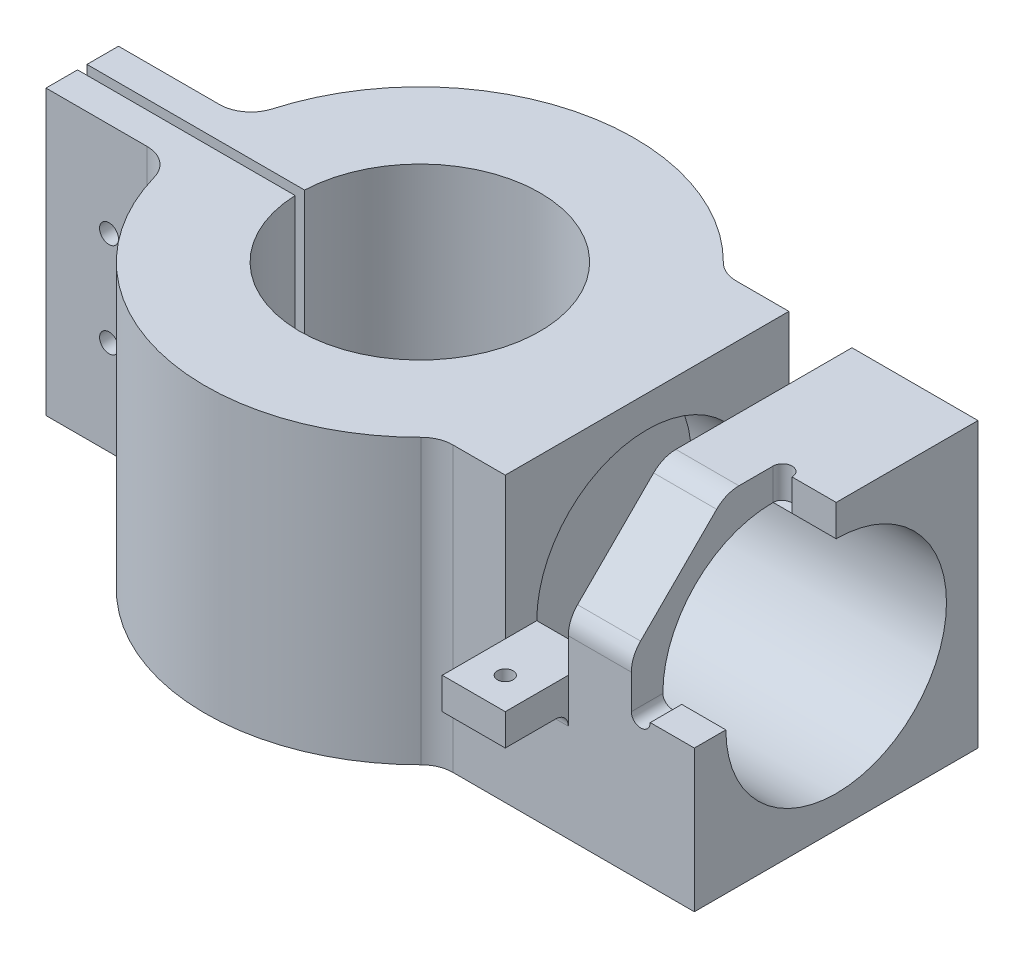
from build123d import *

# Parameters (mm, degrees)
BOSS_EXTRUDE1_DEPTH       = 22.5
F_3_0MM_DOWEL_HOLE1_D     = 3
BOSS_EXTRUDE2_START       = -8.493151603
BOSS_EXTRUDE2_OUTLINE_W   = 45
BOSS_EXTRUDE2_OUTLINE_H   = 45
BOSS_EXTRUDE2_DEPTH       = 40.493151603
SKETCH5_R                 = 17.5
CUT_EXTRUDE1_DEPTH        = 40.493152
SKETCH7_W                 = 10
SKETCH7_H                 = 45
CUT_EXTRUDE2_DEPTH        = 78.641837948
SKETCH8_W                 = 22.5
SKETCH8_H                 = 22.5
CUT_EXTRUDE3_DEPTH        = 10
CUT_EXTRUDE5_OUTLINE_W    = 1.5
CUT_EXTRUDE5_OUTLINE_H    = 5.064430618
CUT_EXTRUDE8_START        = 17.435595673
CUT_EXTRUDE8_DEPTH        = 5.064404327
SKETCH14_W                = 10
SKETCH14_H                = 15
BOSS_EXTRUDE3_DEPTH       = 5
M3X0_5_TAPPED_HOLE1_D     = 2.5
M3X0_5_TAPPED_HOLE1_DEPTH = 7.748924226
M3X0_5_TAPPED_HOLE1_TIP   = 0.751075774
CHAMFER1_SIZE             = 15
FILLET1_R                 = 2
FILLET2_R                 = 5
FILLET3_R                 = 5


# Read off the part's stored shape, not the designer's step: Boss-Extrude2, Cut-Extrude5, Cut-Extrude8
with BuildPart() as part:
    # Sketch3 → Boss-Extrude1 (new, symmetric)
    with BuildSketch(Plane(origin=(0, 0, 0), x_dir=(1, 0, 0), z_dir=(0, 1, 0))):
        with BuildLine():
            Line((-53.560989258, 0.75), (-53.560989258, 5.75))
            Line((-53.560989258, 5.75), (-33.560989258, 5.75))
            ThreePointArc((-33.560989258, 5.75), (34.05, 0), (-33.560989258, -5.75))
            Line((-33.560989258, -5.75), (-53.560989258, -5.75))
            Line((-53.560989258, -5.75), (-53.560989258, -0.75))
            Line((-53.560989258, -0.75), (-19.035230495, -0.75))
            ThreePointArc((-19.035230495, -0.75), (19.05, 0), (-19.035230495, 0.75))
            Line((-19.035230495, 0.75), (-53.560989258, 0.75))
        make_face()
    extrude(amount=BOSS_EXTRUDE1_DEPTH, both=True)

    # Ø3.0mm Dowel Hole1 (through all)
    with Locations(Plane.XY.offset(5.75)):
        with Locations((-43.560989258, 7.5), (-43.560989258, -7.5)):
            Hole(F_3_0MM_DOWEL_HOLE1_D / 2)

    # Boss-Extrude2 outline → Boss-Extrude2 (add)
    with BuildSketch(Plane(origin=(34.05, 0, 0), x_dir=(0, 0, -1), z_dir=(1, 0, 0)).offset(BOSS_EXTRUDE2_START)):
        Rectangle(BOSS_EXTRUDE2_OUTLINE_W, BOSS_EXTRUDE2_OUTLINE_H)
    extrude(amount=BOSS_EXTRUDE2_DEPTH)

    # Sketch5 → Cut-Extrude1 (cut)
    with BuildSketch(Plane(origin=(66.05, 0, 0), x_dir=(0, 0, -1), z_dir=(1, 0, 0))):
        Circle(SKETCH5_R)
    extrude(amount=-CUT_EXTRUDE1_DEPTH, mode=Mode.SUBTRACT)

    # Sketch7 → Cut-Extrude2 (cut, through all)
    with BuildSketch(Plane(origin=(0, 0, 0), x_dir=(1, 0, 0), z_dir=(0, 1, 0))):
        with Locations((41.05, 0)):
            Rectangle(SKETCH7_W, SKETCH7_H)
    extrude(amount=CUT_EXTRUDE2_DEPTH, mode=Mode.SUBTRACT)

    # Sketch8 → Cut-Extrude3 (cut)
    with BuildSketch(Plane(origin=(66.05, 0, 0), x_dir=(0, 0, -1), z_dir=(1, 0, 0))):
        with Locations((-11.25, 11.25)):
            Rectangle(SKETCH8_W, SKETCH8_H)
    extrude(amount=-CUT_EXTRUDE3_DEPTH, mode=Mode.SUBTRACT)

    # Cut-Extrude5 outline → Cut-Extrude5 (revolve, cut)
    with BuildSketch(Plane(origin=(57.55, 0, 0), x_dir=(1, 0, 0), z_dir=(0, -1, 0))):
        with Locations((0.75, 19.967784691)):
            Rectangle(CUT_EXTRUDE5_OUTLINE_W, CUT_EXTRUDE5_OUTLINE_H)
    revolve(axis=Axis((57.55, 0, 0), (0, 0, 1)), mode=Mode.SUBTRACT)

    # Cut-Extrude8 outline → Cut-Extrude8 (cut)
    with BuildSketch(Plane(origin=(0, 0, 0), x_dir=(1, 0, 0), z_dir=(0, 1, 0)).offset(CUT_EXTRUDE8_START)):
        with BuildLine():
            ThreePointArc((59.05, 0), (57.55, 1.5), (56.05, 0))
            Line((56.05, 0), (59.05, 0))
        make_face()
    extrude(amount=CUT_EXTRUDE8_DEPTH, mode=Mode.SUBTRACT)

    # Sketch14 → Boss-Extrude3 (add)
    with BuildSketch(Plane(origin=(0, 0, 0), x_dir=(1, 0, 0), z_dir=(0, 1, 0))):
        with Locations((41.05, -25)):
            Rectangle(SKETCH14_W, SKETCH14_H)
        with Locations((41.05, 25)):
            Rectangle(SKETCH14_W, SKETCH14_H)
    extrude(amount=-BOSS_EXTRUDE3_DEPTH)

    # M3x0.5 Tapped Hole1
    with Locations(Plane(origin=(0, 0, 0), x_dir=(1, 0, 0), z_dir=(0, 1, 0))):
        with Locations((41.05, 27.5), (41.05, -27.5)):
            Hole(M3X0_5_TAPPED_HOLE1_D / 2, depth=M3X0_5_TAPPED_HOLE1_DEPTH)
            with Locations((0, 0, -(M3X0_5_TAPPED_HOLE1_DEPTH + M3X0_5_TAPPED_HOLE1_TIP / 2))):  # 118° drill point
                Cone(0, M3X0_5_TAPPED_HOLE1_D / 2, M3X0_5_TAPPED_HOLE1_TIP, mode=Mode.SUBTRACT)

    # Chamfer1
    chamfer1_edges = [part.edges().sort_by_distance(p)[0] for p in [
        (51.05, 22.5, 22.5),
    ]]
    chamfer(chamfer1_edges, length=CHAMFER1_SIZE)

    # Fillet1
    fillet1_edges = [part.edges().sort_by_distance(p)[0] for p in [
        (41.05, -5, 22.5),
        (41.05, -5, -22.5),
    ]]
    fillet(fillet1_edges, radius=FILLET1_R)

    # Fillet2
    fillet2_edges = [part.edges().sort_by_distance(p)[0] for p in [
        (51.05, 22.5, 7.5),
        (51.05, 7.5, 22.5),
    ]]
    fillet(fillet2_edges, radius=FILLET2_R)

    # Fillet3
    fillet3_edges = [part.edges().sort_by_distance(p)[0] for p in [
        (-33.560989258, 0, -5.75),
        (-33.560989258, 0, 5.75),
        (25.556848397, 0, -22.5),
        (25.556848397, 0, 22.5),
    ]]
    fillet(fillet3_edges, radius=FILLET3_R)


solid = part.part
